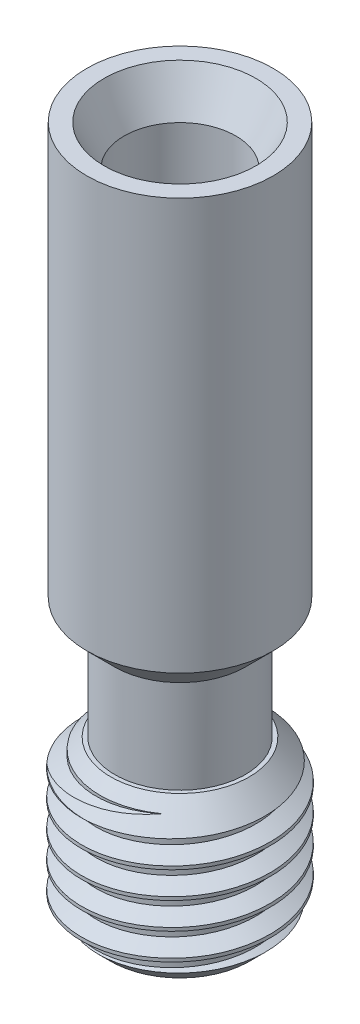
from build123d import *

# Parameters (mm, degrees)
SKETCH1_R               = 3.5
BOSS_EXTRUDE1_DEPTH     = 8.25
SKETCH2_R               = 2.45
BOSS_EXTRUDE2_DEPTH     = 3.5
SKETCH3_R               = 3
BOSS_EXTRUDE3_DEPTH     = 6
SKETCH4_R               = 2.1
CUT_EXTRUDE1_DEPTH      = 27.466960536
CHAMFER1_SIZE           = 0.75
CHAMFER1_SIZE2          = 1.5
THREAD1_PITCH           = 1
THREAD1_FROM            = 1
THREAD1_TO              = 7
SKETCH7_OUTSIDE_W       = 26.654
SKETCH7_OUTSIDE_H       = 26.654
SKETCH7_OUTSIDE_R       = 2.6
CUT_EXTRUDE2_DEPTH      = 6
CUT_EXTRUDE2_DRAFT      = -45
MIRROR1_COPY_1_SKETCH_W = 26.654
MIRROR1_COPY_1_SKETCH_H = 26.654
MIRROR1_COPY_1_SKETCH_R = 2.6
MIRROR1_COPY_1_DEPTH    = 6
MIRROR1_COPY_1_DRAFT    = -45
CHAMFER2_SIZE           = 1.05


with BuildPart() as part:
    # Sketch1 → Boss-Extrude1 (new, symmetric)
    with BuildSketch(Plane(origin=(0, 0, 0), x_dir=(1, 0, 0), z_dir=(0, 1, 0))):
        with Locations(Location((0, 0, 0), (0, 0, 270))):
            Circle(SKETCH1_R)
    extrude(amount=BOSS_EXTRUDE1_DEPTH, both=True)

    # Sketch2 → Boss-Extrude2 (add)
    with BuildSketch(Plane.XZ.offset(8.25)):
        with Locations(Location((0, 0, 0), (0, 0, 270))):
            Circle(SKETCH2_R)
    extrude(amount=BOSS_EXTRUDE2_DEPTH)

    # Sketch3 → Boss-Extrude3 (add)
    with BuildSketch(Plane.XZ.offset(11.75)):
        with Locations(Location((0, 0, 0), (0, 0, 270))):
            Circle(SKETCH3_R)
    extrude(amount=BOSS_EXTRUDE3_DEPTH)

    # Sketch4 → Cut-Extrude1 (cut, through all)
    with BuildSketch(Plane(origin=(0, 8.25, 0), x_dir=(1, 0, 0), z_dir=(0, 1, 0))):
        with Locations(Location((0, 0, 0), (0, 0, 270))):
            Circle(SKETCH4_R)
    extrude(amount=-CUT_EXTRUDE1_DEPTH, mode=Mode.SUBTRACT)

    # Chamfer1
    chamfer1_edges = [part.edges().sort_by_distance(p)[0] for p in [
        (0, 8.25, -2.1),
    ]]
    chamfer1_side = [part.faces().sort_by_distance(p)[0] for p in [
        (0, 8.25, -3.401005051),
    ]]
    chamfer(chamfer1_edges, length=CHAMFER1_SIZE, length2=CHAMFER1_SIZE2, reference=chamfer1_side[0])

    # Thread1: arcs per turn and ends read off the stored shape
    # Thread1: the profile of Thread Profile1 profile screwed along a right-hand helix through 7 turns, 8 arcs to a turn; built about Z, then put on its axis
    thread1_z = Axis((0, 0, 0), (0, 0, 1))
    thread1_corners = [(2.9997, 0, -0.000173205), (3.541265875, 0, 0.312499999), (3.541265875, 0, 0.437499999), (2.9997, 0, 0.750173202)]
    with BuildLine(mode=Mode.PRIVATE) as thread1_profile:
        Line(thread1_corners[0], thread1_corners[1])
        Line(thread1_corners[1], thread1_corners[2])
        Line(thread1_corners[2], thread1_corners[3])
        Line(thread1_corners[3], thread1_corners[0])
    thread1_cap = Face(thread1_profile.wire())
    thread1_turn_angles = [0, 22.5, 45, 67.5, 90, 112.5, 135, 157.5, 180, 202.5, 225, 247.5, 270, 292.5, 315, 337.5, 360]
    thread1_turn_weights = [1, 0.9238795325112867, 1, 0.9238795325112867, 1, 0.9238795325112867, 1, 0.9238795325112867, 1, 0.9238795325112867, 1, 0.9238795325112867, 1, 0.9238795325112867, 1, 0.9238795325112867, 1]
    thread1_turn_rails = [Edge.make_bspline([Vector(p[0], p[1], 0).rotate(thread1_z, thread1_turn_angles[k]) / thread1_turn_weights[k] + Vector(0, 0, p[2] + THREAD1_PITCH * thread1_turn_angles[k] / 360) for k in range(17)], [0, 0, 0, 1, 1, 2, 2, 3, 3, 4, 4, 5, 5, 6, 6, 7, 7, 8, 8, 8], 2, thread1_turn_weights) for p in thread1_corners]
    thread1_turn_sides = [Face.make_surface_from_curves(thread1_turn_rails[p[0]], thread1_turn_rails[p[1]]) for p in [(0, 1), (1, 2), (2, 3), (3, 0)]]
    thread1 = Plane(origin=(0, -18.75, 0), x_dir=(1, 0, 0), z_dir=(0, 1, 0)) * split(split(Solid(Shell([*[p.moved(Location((0, 0, THREAD1_PITCH * i))) for i in range(7) for p in thread1_turn_sides], thread1_cap, thread1_cap.rotate(thread1_z, 2520).moved(Location((0, 0, THREAD1_PITCH * 2520 / 360)))])), bisect_by=Plane.XY.offset(THREAD1_FROM), keep=Keep.TOP, mode=Mode.PRIVATE), bisect_by=Plane.XY.offset(THREAD1_TO), keep=Keep.BOTTOM, mode=Mode.PRIVATE)
    add(thread1)


with BuildPart() as cut_extrude2_tool:
    # Sketch7 outside → Cut-Extrude2 (with draft: the straight prism first)
    with BuildSketch(Plane.XZ.offset(17.75)):
        Rectangle(SKETCH7_OUTSIDE_W, SKETCH7_OUTSIDE_H)
        Circle(SKETCH7_OUTSIDE_R, mode=Mode.SUBTRACT)
    extrude(amount=-CUT_EXTRUDE2_DEPTH)
    # Cut-Extrude2: the draft: its side faces are tilted about the plane it starts from
    cut_extrude2_sides = [cut_extrude2_tool.faces().sort_by_distance(p)[0] for p in [
        (0, -14.75, -13.327),
        (13.327, -14.75, 0),
        (0, -14.75, 13.327),
        (-13.327, -14.75, 0),
        (-2.6, -14.75, 0),
    ]]
    draft(cut_extrude2_sides, Plane.XZ.offset(17.75), CUT_EXTRUDE2_DRAFT)


with BuildPart() as part_1:
    add(part.part)

    # Cut-Extrude2: cut by cut_extrude2_tool
    add(cut_extrude2_tool.part, mode=Mode.SUBTRACT)


with BuildPart() as mirror1_copy_1_tool:
    # Mirror1 copy 1 sketch → Mirror1 copy 1 (with draft: the straight prism first)
    with BuildSketch(Plane(origin=(0, -11.75, 0), x_dir=(1, 0, 0), z_dir=(0, 1, 0))):
        Rectangle(MIRROR1_COPY_1_SKETCH_W, MIRROR1_COPY_1_SKETCH_H)
        Circle(MIRROR1_COPY_1_SKETCH_R, mode=Mode.SUBTRACT)
    extrude(amount=-MIRROR1_COPY_1_DEPTH)
    # Mirror1 copy 1: the draft: its side faces are tilted about the plane it starts from
    mirror1_copy_1_sides = [mirror1_copy_1_tool.faces().sort_by_distance(p)[0] for p in [
        (0, -14.75, -13.327),
        (13.327, -14.75, 0),
        (0, -14.75, 13.327),
        (-13.327, -14.75, 0),
        (-2.6, -14.75, 0),
    ]]
    draft(mirror1_copy_1_sides, Plane(origin=(0, -11.75, 0), x_dir=(1, 0, 0), z_dir=(0, 1, 0)), MIRROR1_COPY_1_DRAFT)


with BuildPart() as part_2:
    add(part_1.part)

    # Mirror1 copy 1: cut by mirror1_copy_1_tool
    add(mirror1_copy_1_tool.part, mode=Mode.SUBTRACT)

    # Chamfer2
    chamfer2_edges = [part_2.edges().sort_by_distance(p)[0] for p in [
        (0, -8.25, -3.5),
    ]]
    chamfer(chamfer2_edges, length=CHAMFER2_SIZE - 0.0001)  # a hair under: the kernel refuses the full size


solid = part_2.part
